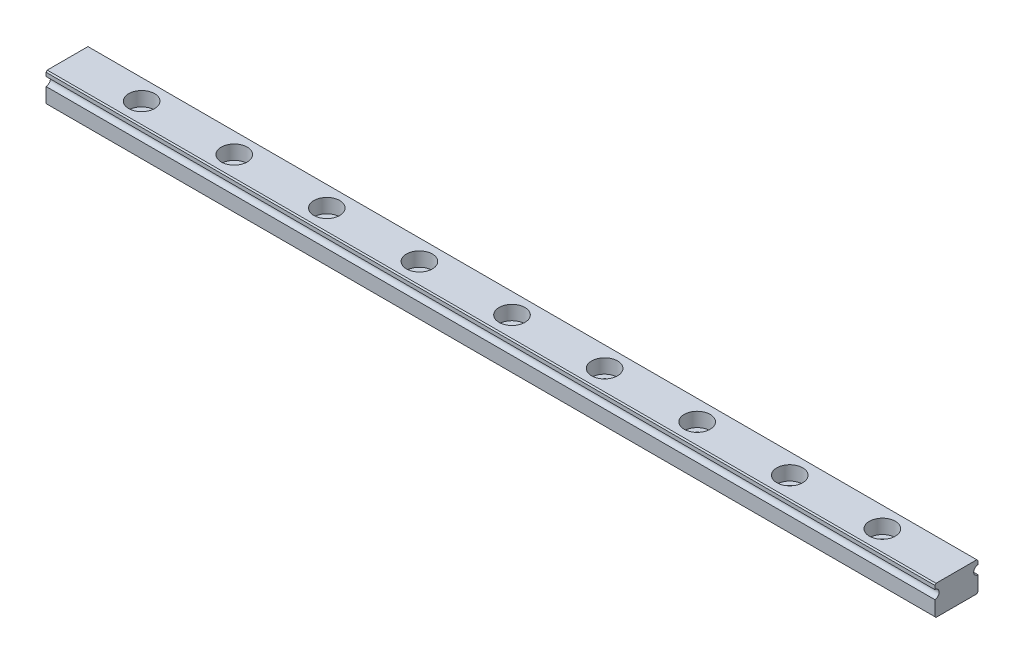
from build123d import *

# Parameters (mm, degrees)
EXTRUDE_1_DEPTH          = 144
SKETCH_2_R               = 2.1
CUT_EXTRUDE_1_DEPTH      = 2.3
CUT_EXTRUDE_2_DEPTH      = 145.122299994
CUT_EXTRUDE_2_DEPTH_BACK = 145.122299994
SKETCH_3_R               = 1.2


with BuildPart() as part:
    # 草图1 → 凸台-拉伸1 (new body)
    with BuildSketch(Plane(origin=(0, 0, 0), x_dir=(0, 0, -1), z_dir=(1, 0, 0))):
        with BuildLine():
            Line((3.497989899, 0.202010101), (3.497989899, -2.197989899))
            Line((3.497989899, -2.197989899), (3.3, -2.395979797))
            Line((3.3, -2.395979797), (-3.3, -2.395979797))
            Line((-3.3, -2.395979797), (-3.497989899, -2.197989899))
            Line((-3.497989899, -2.197989899), (-3.497989899, 0.202010101))
            ThreePointArc((-3.497989899, 0.202010101), (-2.797989899, 0.902010101), (-3.497989899, 1.602010101))
            Line((-3.497989899, 1.602010101), (-3.497989899, 2.202010101))
            Line((-3.497989899, 2.202010101), (-3.3, 2.4))
            Line((-3.3, 2.4), (3.3, 2.4))
            Line((3.3, 2.4), (3.497989899, 2.202010101))
            Line((3.497989899, 2.202010101), (3.497989899, 1.602010101))
            ThreePointArc((3.497989899, 1.602010101), (2.797989899, 0.902010101), (3.497989899, 0.202010101))
        make_face()
    extrude(amount=EXTRUDE_1_DEPTH)

    # 草图2 → 切除-拉伸1 (cut)
    with BuildSketch(Plane(origin=(0, 2.4, 0), x_dir=(1, 0, 0), z_dir=(0, 1, 0))):
        with Locations((12, 0)):
            Circle(SKETCH_2_R)
        with Locations((27, 0)):
            Circle(SKETCH_2_R)
        with Locations((42, 0)):
            Circle(SKETCH_2_R)
        with Locations((57, 0)):
            Circle(SKETCH_2_R)
        with Locations((72, 0)):
            Circle(SKETCH_2_R)
        with Locations((87, 0)):
            Circle(SKETCH_2_R)
        with Locations((102, 0)):
            Circle(SKETCH_2_R)
        with Locations((117, 0)):
            Circle(SKETCH_2_R)
        with Locations((132, 0)):
            Circle(SKETCH_2_R)
        with Locations((147, 0)):
            Circle(SKETCH_2_R)
        with Locations((162, 0)):
            Circle(SKETCH_2_R)
        with Locations((177, 0)):
            Circle(SKETCH_2_R)
        with Locations((192, 0)):
            Circle(SKETCH_2_R)
        with Locations((207, 0)):
            Circle(SKETCH_2_R)
        with Locations((222, 0)):
            Circle(SKETCH_2_R)
    extrude(amount=-CUT_EXTRUDE_1_DEPTH, mode=Mode.SUBTRACT)

    # 草图3 → 切除-拉伸2 (cut, two sides: drawn at the far end of the back side and taken through both)
    with BuildSketch(Plane(origin=(0, 2.4, 0), x_dir=(1, 0, 0), z_dir=(0, 1, 0)).offset(-CUT_EXTRUDE_2_DEPTH_BACK)):
        with Locations((12, 0)):
            Circle(SKETCH_3_R)
        with Locations((27, 0)):
            Circle(SKETCH_3_R)
        with Locations((42, 0)):
            Circle(SKETCH_3_R)
        with Locations((57, 0)):
            Circle(SKETCH_3_R)
        with Locations((72, 0)):
            Circle(SKETCH_3_R)
        with Locations((87, 0)):
            Circle(SKETCH_3_R)
        with Locations((102, 0)):
            Circle(SKETCH_3_R)
        with Locations((117, 0)):
            Circle(SKETCH_3_R)
        with Locations((132, 0)):
            Circle(SKETCH_3_R)
        with Locations((147, 0)):
            Circle(SKETCH_3_R)
        with Locations((162, 0)):
            Circle(SKETCH_3_R)
        with Locations((177, 0)):
            Circle(SKETCH_3_R)
        with Locations((192, 0)):
            Circle(SKETCH_3_R)
        with Locations((207, 0)):
            Circle(SKETCH_3_R)
        with Locations((222, 0)):
            Circle(SKETCH_3_R)
    extrude(amount=CUT_EXTRUDE_2_DEPTH + CUT_EXTRUDE_2_DEPTH_BACK, mode=Mode.SUBTRACT)


solid = part.part
